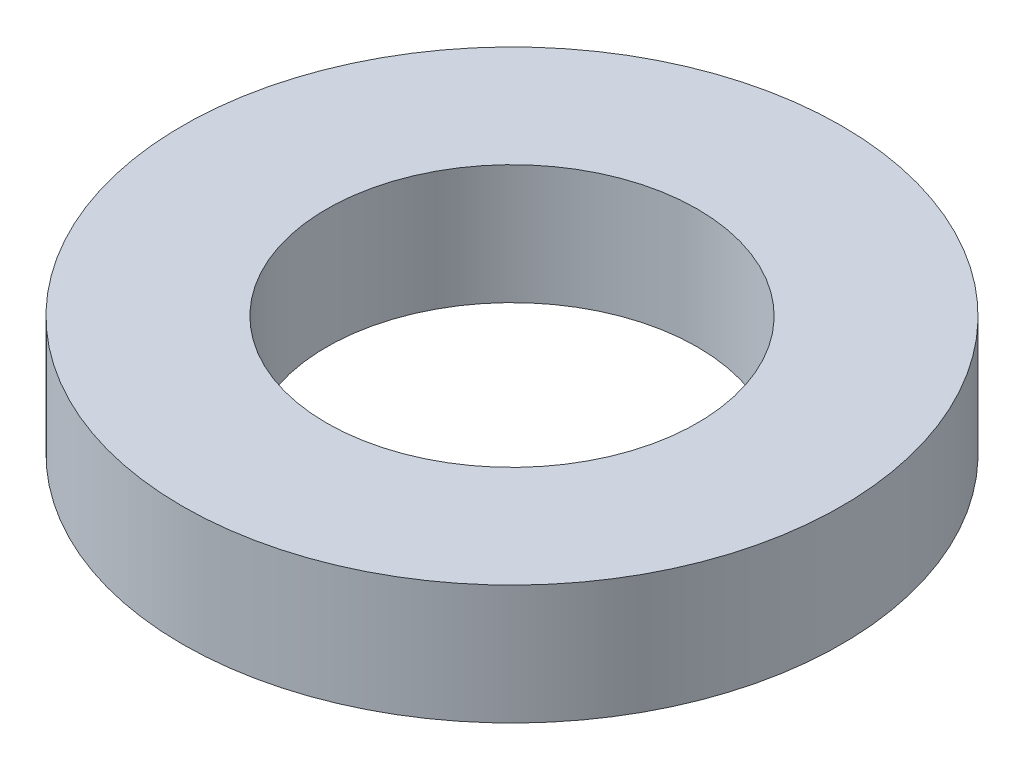
from build123d import *

# Parameters (mm, degrees)
SKETCH1_R           = 80
BOSS_EXTRUDE1_DEPTH = 29
SKETCH2_R           = 45
CUT_EXTRUDE1_DEPTH  = 117.79469166


with BuildPart() as part:
    # Sketch1 → Boss-Extrude1 (new body)
    with BuildSketch(Plane(origin=(0, 0, 0), x_dir=(1, 0, 0), z_dir=(0, 1, 0))):
        Circle(SKETCH1_R)
    extrude(amount=BOSS_EXTRUDE1_DEPTH)

    # Sketch2 → Cut-Extrude1 (cut, through all)
    with BuildSketch(Plane(origin=(0, 0, 0), x_dir=(1, 0, 0), z_dir=(0, 1, 0))):
        Circle(SKETCH2_R)
    extrude(amount=CUT_EXTRUDE1_DEPTH, mode=Mode.SUBTRACT)


solid = part.part
